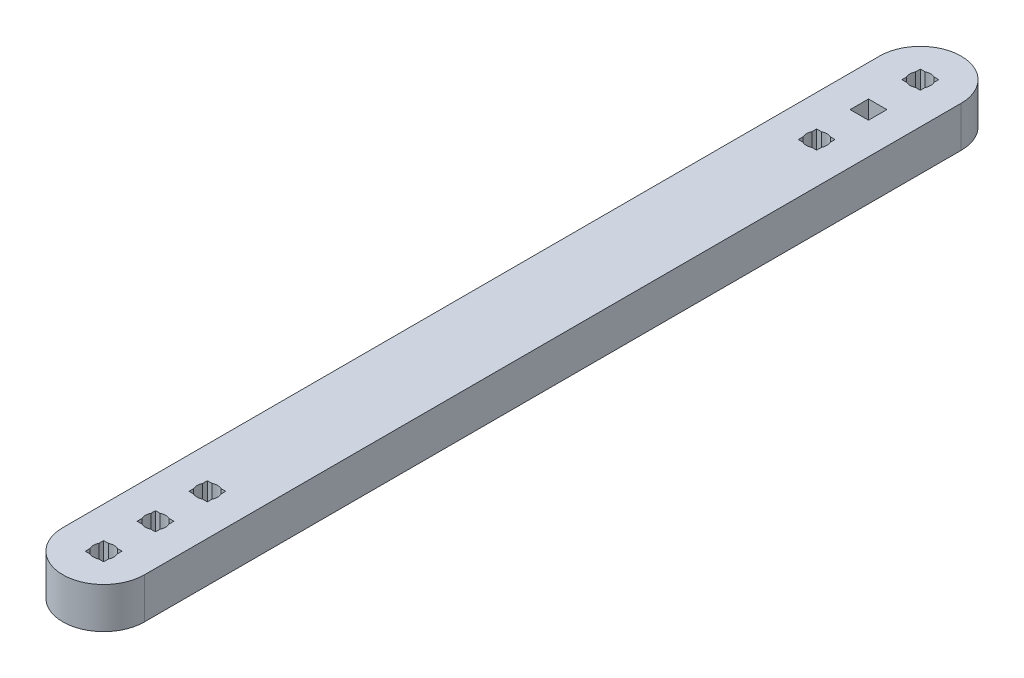
from build123d import *

# Parameters (mm, degrees)
SKETCH1_R           = 2.5
BOSS_EXTRUDE1_DEPTH = 10
SKETCH2_W           = 4.5
SKETCH2_H           = 4.5
CUT_EXTRUDE1_DEPTH  = 111.905365064
CUT_EXTRUDE2_DEPTH  = 5


with BuildPart() as part:
    # Sketch1 → Boss-Extrude1 (new body)
    with BuildSketch(Plane(origin=(0, 0, 0), x_dir=(1, 0, 0), z_dir=(0, 1, 0))):
        with BuildLine():
            ThreePointArc((-10, -100), (0, -110), (10, -100))
            Line((10, -100), (10, 100))
            ThreePointArc((10, 100), (0, 110), (-10, 100))
            Line((-10, 100), (-10, -100))
        make_face()
        with Locations((0, -100)):
            Circle(SKETCH1_R, mode=Mode.SUBTRACT)
        with Locations((0, -87.3)):
            Circle(SKETCH1_R, mode=Mode.SUBTRACT)
        with Locations((0, -74.6)):
            Circle(SKETCH1_R, mode=Mode.SUBTRACT)
        with Locations((0, 74.6)):
            Circle(SKETCH1_R, mode=Mode.SUBTRACT)
        with Locations((0, 100)):
            Circle(SKETCH1_R, mode=Mode.SUBTRACT)
    extrude(amount=BOSS_EXTRUDE1_DEPTH)

    # Sketch2 → Cut-Extrude1 (cut, through all)
    with BuildSketch(Plane.XZ):
        with Locations((0, 100)):
            Rectangle(SKETCH2_W, SKETCH2_H)
        with Locations((0, 87.3)):
            Rectangle(SKETCH2_W, SKETCH2_H)
        with Locations((0, 74.6)):
            Rectangle(SKETCH2_W, SKETCH2_H)
        with Locations((0, -74.6)):
            Rectangle(SKETCH2_W, SKETCH2_H)
        with Locations((0, -87.3)):
            Rectangle(SKETCH2_W, SKETCH2_H)
        with Locations((0, -100)):
            Rectangle(SKETCH2_W, SKETCH2_H)
    extrude(amount=-CUT_EXTRUDE1_DEPTH, mode=Mode.SUBTRACT)

    # Sketch3 → Cut-Extrude2 (cut)
    with BuildSketch(Plane.XZ):
        Polygon((5, 102.51), (2.46, 105.05), (-2.46, 105.05), (-5, 102.51), (-5, 72.09), (-2.46, 69.55), (2.46, 69.55), (5, 72.09), align=None)
        Polygon((5, -72.09), (2.46, -69.55), (-2.46, -69.55), (-5, -72.09), (-5, -102.51), (-2.46, -105.05), (2.46, -105.05), (5, -102.51), align=None)
    extrude(amount=-CUT_EXTRUDE2_DEPTH, mode=Mode.SUBTRACT)


solid = part.part
